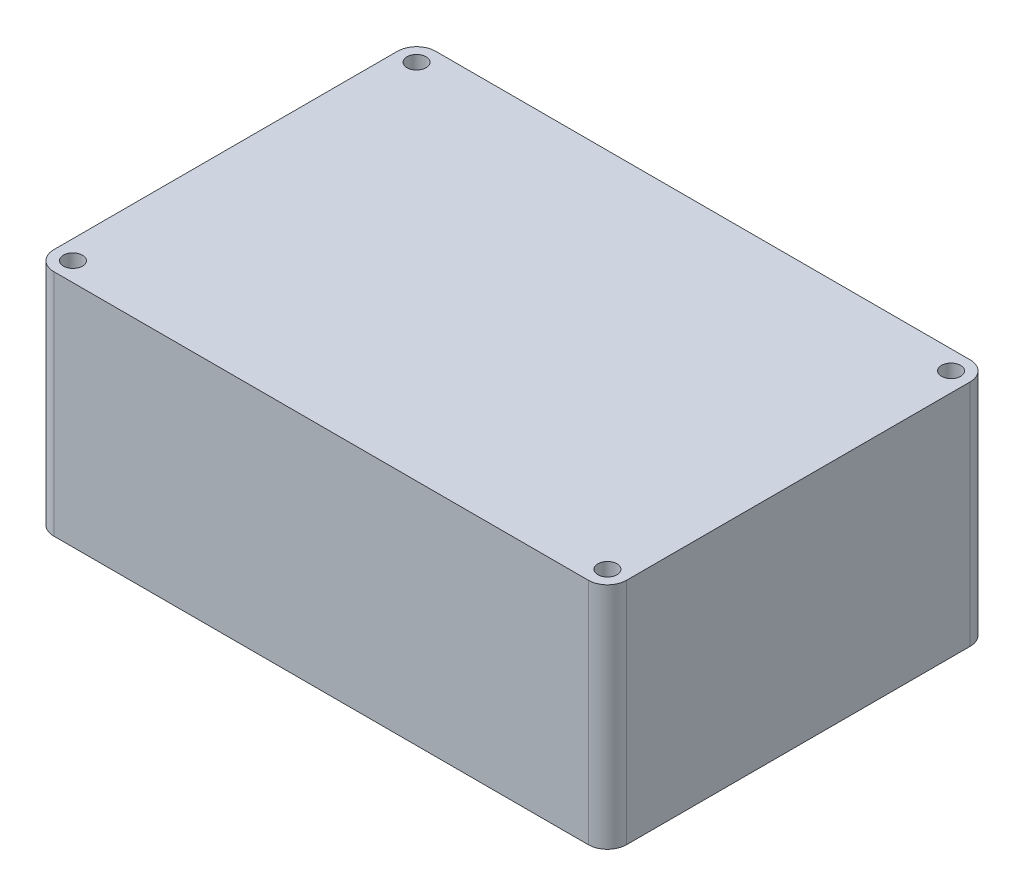
from build123d import *

# Parameters (mm, degrees)
CROQUIS1_W                                 = 300
CROQUIS1_H                                 = 200
SALIENTE_EXTRUIR1_DEPTH                    = 120
REDONDEO1_R                                = 10
CROQUIS2_R                                 = 5
CORTAR_EXTRUIR1_DEPTH                      = 217.564078277
SIMETR_A1_AT_THE_SECOND_PLANE_COPY_1_SKE_R = 5
SIMETR_A1_AT_THE_SECOND_PLANE_COPY_1_DEPTH = 217.564078277


with BuildPart() as part:
    # Croquis1 → Saliente-Extruir1 (new body)
    with BuildSketch(Plane(origin=(0, 0, 0), x_dir=(1, 0, 0), z_dir=(0, 1, 0))):
        Rectangle(CROQUIS1_W, CROQUIS1_H)
    extrude(amount=SALIENTE_EXTRUIR1_DEPTH)

    # Redondeo1
    redondeo1_edges = [part.edges().sort_by_distance(p)[0] for p in [
        (-150, 60, -100),
        (150, 60, -100),
        (150, 60, 100),
        (-150, 60, 100),
    ]]
    fillet(redondeo1_edges, radius=REDONDEO1_R)

    # Croquis2 → Cortar-Extruir1 (cut, through all)
    with BuildSketch(Plane(origin=(0, 120, 0), x_dir=(1, 0, 0), z_dir=(0, 1, 0))):
        with Locations((-140, 90)):
            Circle(CROQUIS2_R)
    cortar_extruir1 = extrude(amount=-CORTAR_EXTRUIR1_DEPTH, mode=Mode.SUBTRACT)

    # Simetría1: Cortar-Extruir1 across plane
    add(cortar_extruir1.mirror(Plane.XY), mode=Mode.SUBTRACT)

    # Simetría1 at the second plane: Cortar-Extruir1 across plane
    add(cortar_extruir1.mirror(Plane(origin=(0, 0, 0), x_dir=(0, 0, 1), z_dir=(1, 0, 0))), mode=Mode.SUBTRACT)

    # Simetría1 at the second plane copy 1 ske → Simetría1 at the second plane copy 1 (cut, through all)
    with BuildSketch(Plane(origin=(0, 120, 0), x_dir=(-1, 0, 0), z_dir=(0, 1, 0))):
        with Locations((-140, 90)):
            Circle(SIMETR_A1_AT_THE_SECOND_PLANE_COPY_1_SKE_R)
    extrude(amount=-SIMETR_A1_AT_THE_SECOND_PLANE_COPY_1_DEPTH, mode=Mode.SUBTRACT)


solid = part.part
